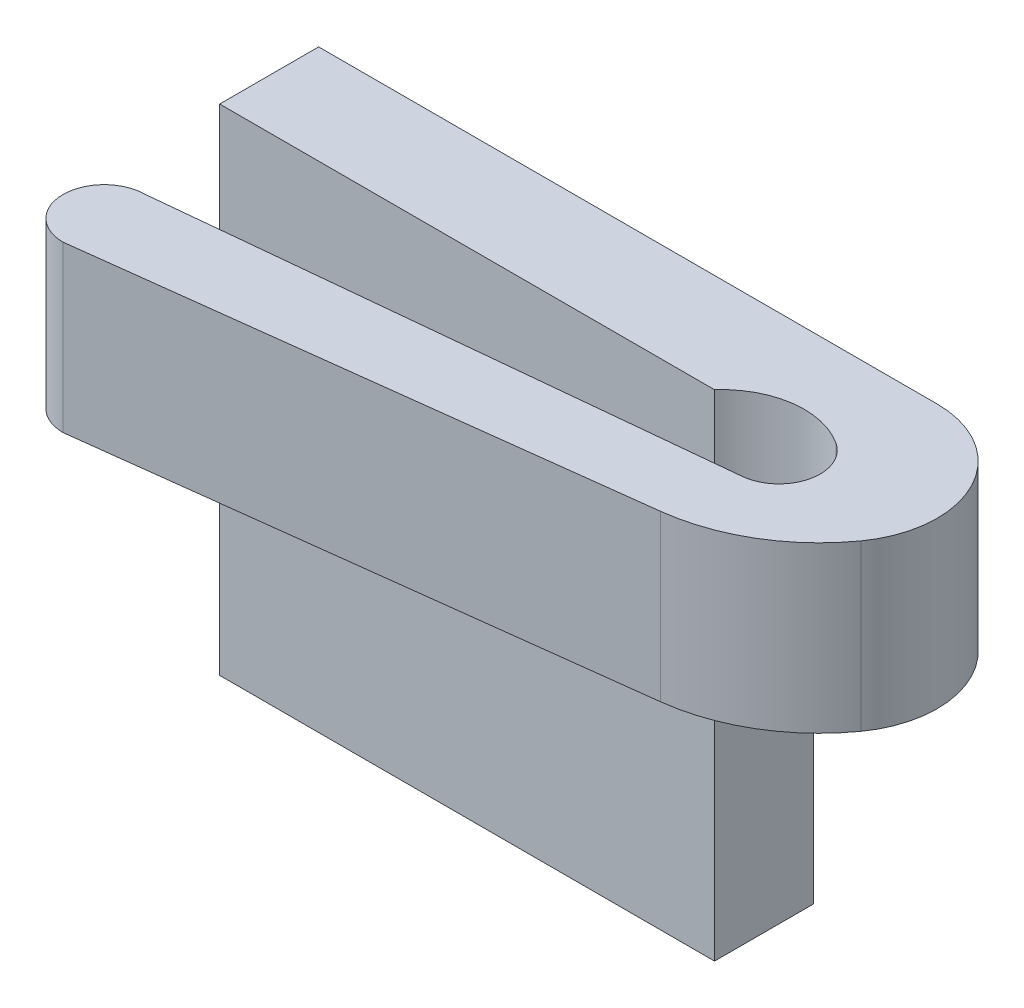
from build123d import *

# Parameters (mm, degrees)
BOSS_EXTRUDE1_DEPTH = 2
SKETCH2_W           = 6
SKETCH2_H           = 1.2
BOSS_EXTRUDE2_DEPTH = 4
FILLET1_DEPTH       = 2


with BuildPart() as part:
    # Sketch1 → Boss-Extrude1 (new body)
    with BuildSketch(Plane(origin=(0, 0, 0), x_dir=(1, 0, 0), z_dir=(0, 1, 0))):
        with BuildLine():
            Line((0, 1.2), (7.5, 1.2))
            ThreePointArc((7.5, 1.2), (8.567707825, 0.547722558), (8.474679434, -0.7))
            ThreePointArc((8.474679434, -0.7), (7.807430734, -1.311314361), (6.951049145, -1.603780854))
            Line((6.951049145, -1.603780854), (0.5, -2.4))
            ThreePointArc((0.5, -2.4), (0, -1.9), (0.5, -1.4))
            Line((0.5, -1.4), (7.5, -0.7))
            ThreePointArc((7.5, -0.7), (7.642928579, -0.35), (7.5, 0))
            ThreePointArc((7.5, 0), (6.75, 0.338562172), (6, 0))
            Line((6, 0), (0, 0))
            Line((0, 0), (0, 1.2))
        make_face()
    extrude(amount=BOSS_EXTRUDE1_DEPTH)

    # Sketch2 → Boss-Extrude2 (add)
    with BuildSketch(Plane(origin=(0, 0, 0), x_dir=(1, 0, 0), z_dir=(0, 1, 0))):
        with Locations((3, 0.6)):
            Rectangle(SKETCH2_W, SKETCH2_H)
    extrude(amount=-BOSS_EXTRUDE2_DEPTH)

    # Fillet1: read off the stored shape, not the designer's step
    # Fillet1 outline → Fillet1 (add)
    with BuildSketch(Plane(origin=(0, 0, 0), x_dir=(1, 0, 0), z_dir=(0, 1, 0))):
        with BuildLine():
            ThreePointArc((7.5, 0), (7.407145524, 0.092325902), (7.303023614, 0.171727751))
            ThreePointArc((7.303023614, 0.171727751), (7.511802782, -0.365240542), (7.076263667, -0.742373633))
            Line((7.076263667, -0.742373633), (7.5, -0.7))
            ThreePointArc((7.5, -0.7), (7.642928579, -0.35), (7.5, 0))
        make_face()
    extrude(amount=FILLET1_DEPTH)


solid = part.part
